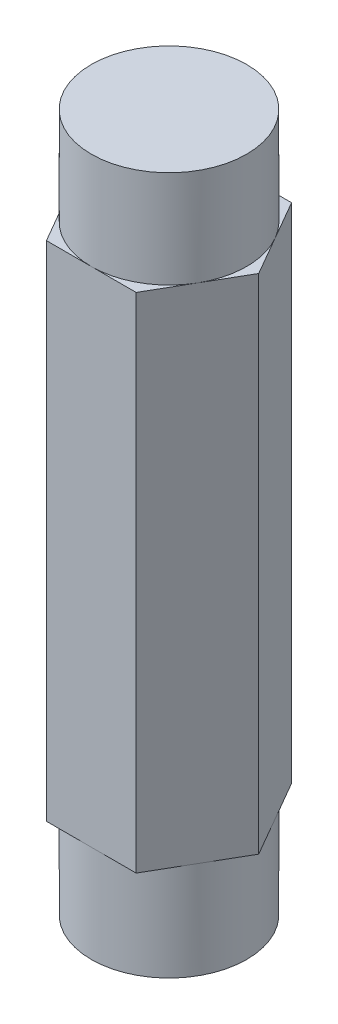
from build123d import *

# Parameters (mm, degrees)
BOSS_EXTRUDE1_DEPTH = 28.4988
SKETCH2_OUTSIDE_W   = 28.706
SKETCH2_OUTSIDE_H   = 26.742
SKETCH2_OUTSIDE_R   = 6.35
CUT_EXTRUDE1_DEPTH  = 7.9502


with BuildPart() as part:
    # Sketch1 → Boss-Extrude1 (new, symmetric)
    with BuildSketch(Plane(origin=(0, 0, 0), x_dir=(1, 0, 0), z_dir=(0, 1, 0))):
        Polygon((3.666174209, -6.35), (7.332348419, 0), (3.666174209, 6.35), (-3.666174209, 6.35), (-7.332348419, 0), (-3.666174209, -6.35), align=None)
    extrude(amount=BOSS_EXTRUDE1_DEPTH, both=True)

    # Sketch2 outside → Cut-Extrude1 (cut)
    with BuildSketch(Plane(origin=(0, 28.4988, 0), x_dir=(1, 0, 0), z_dir=(0, 1, 0))):
        Rectangle(SKETCH2_OUTSIDE_W, SKETCH2_OUTSIDE_H)
        Circle(SKETCH2_OUTSIDE_R, mode=Mode.SUBTRACT)
    cut_extrude1 = extrude(amount=-CUT_EXTRUDE1_DEPTH, mode=Mode.SUBTRACT)

    # Mirror1: Cut-Extrude1 across plane
    add(cut_extrude1.mirror(Plane.ZX), mode=Mode.SUBTRACT)


solid = part.part
